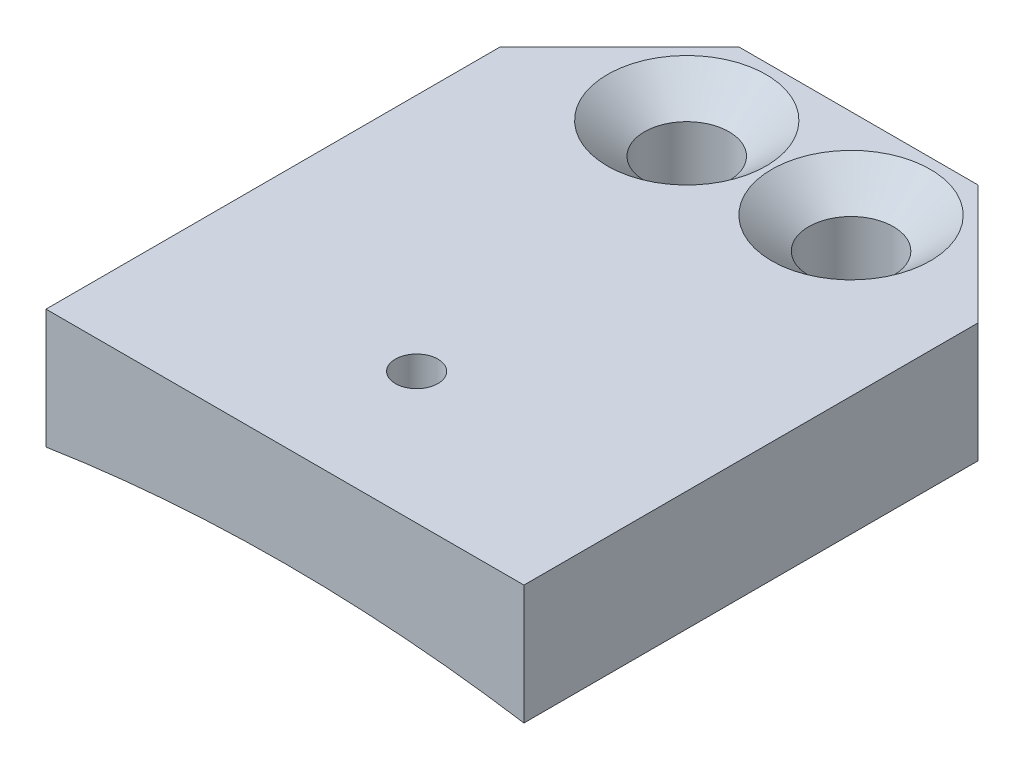
from build123d import *

# Parameters (mm, degrees)
BOSS_EXTRUDE1_DEPTH                               = 6.35
CSK_FOR_8_FLAT_HEAD_MACHINE_SCREW_100_D           = 4.4958
CSK_FOR_8_FLAT_HEAD_MACHINE_SCREW_100_CSINK_D     = 8.4328
CSK_FOR_8_FLAT_HEAD_MACHINE_SCREW_100_CSINK_ANGLE = 100
SKETCH2_R                                         = 82.042
CUT_EXTRUDE1_DEPTH                                = 43.217023873
SKETCH5_R                                         = 1.1303
CUT_EXTRUDE2_DEPTH                                = 35.271884391


with BuildPart() as part:
    # Sketch1 → Boss-Extrude1 (new body)
    with BuildSketch(Plane(origin=(0, 0, 0), x_dir=(1, 0, 0), z_dir=(0, 1, 0))):
        Polygon((-28.511825699, 11.575271113), (-22.161825699, 17.925271113), (-9.461825699, 17.925271113), (-3.111825699, 11.575271113), (-3.111825699, -12.554728887), (-28.511825699, -12.554728887), align=None)
    extrude(amount=BOSS_EXTRUDE1_DEPTH)

    # CSK for #8 Flat Head Machine Screw (100)1 (through all)
    with Locations(Plane(origin=(0, 6.35, 0), x_dir=(1, 0, 0), z_dir=(0, 1, 0))):
        with Locations((-20.177450699, 13.162771113), (-11.446200699, 13.162771113)):
            CounterSinkHole(CSK_FOR_8_FLAT_HEAD_MACHINE_SCREW_100_D / 2, CSK_FOR_8_FLAT_HEAD_MACHINE_SCREW_100_CSINK_D / 2, counter_sink_angle=CSK_FOR_8_FLAT_HEAD_MACHINE_SCREW_100_CSINK_ANGLE)

    # Sketch2 → Cut-Extrude1 (cut, through all)
    with BuildSketch(Plane.XY.offset(12.554728887)):
        with Locations((-15.811825699, -81.053067579)):
            Circle(SKETCH2_R)
    extrude(amount=-CUT_EXTRUDE1_DEPTH, mode=Mode.SUBTRACT)

    # Sketch5 → Cut-Extrude2 (cut, through all)
    with BuildSketch(Plane(origin=(0, 6.35, 0), x_dir=(1, 0, 0), z_dir=(0, 1, 0))):
        with Locations((-15.799380503, -5.569728887)):
            Circle(SKETCH5_R)
    extrude(amount=-CUT_EXTRUDE2_DEPTH, mode=Mode.SUBTRACT)


solid = part.part
